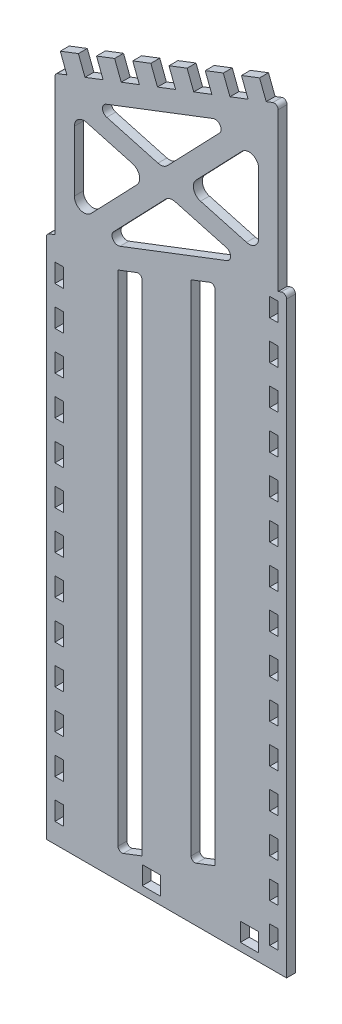
from build123d import *

# Parameters (mm, degrees)
BOSS_EXTRUDE1_DEPTH = 1.4605
SKETCH3_W           = 6.35
SKETCH3_H           = 2.921
BOSS_EXTRUDE2_DEPTH = 6.0452
CUT_EXTRUDE2_DEPTH  = 147.066332108
BOSS_EXTRUDE3_DEPTH = 2.921
SKETCH6_3_W         = 2.75
SKETCH6_3_H         = 6.096
CUT_EXTRUDE3_DEPTH  = 147.77801096
SKETCH6_4_W         = 2.75
SKETCH6_4_H         = 6.096
CUT_EXTRUDE4_DEPTH  = 147.77801096
LPATTERN1_COUNT     = 13
LPATTERN1_PITCH     = 12.7
LPATTERN2_COUNT     = 15
LPATTERN2_PITCH     = 12.7
CUT_EXTRUDE5_DEPTH  = 147.77801096
FILLET1_R           = 1.27
FILLET2_R           = 3.175
FILLET3_R           = 1.905
SKETCH9_W           = 6
SKETCH9_H           = 6
CUT_EXTRUDE6_DEPTH  = 147.77801096


with BuildPart() as part:
    # Sketch1 → Boss-Extrude1 (new, symmetric)
    with BuildSketch(Plane.XY):
        Polygon((-36.517931963, 109.22), (36.517931963, 137.255841429), (36.517931963, -109.22), (-36.517931963, -109.22), align=None)
    extrude(amount=BOSS_EXTRUDE1_DEPTH, both=True)

    # Sketch3 → Boss-Extrude2 (add)
    with BuildSketch(Plane(origin=(-41.231132307, 107.410771898, 0), x_dir=(0.9335804264972012, 0.35836794954530177, 0), z_dir=(-0.35836794954530177, 0.9335804264972012, 0))):
        with Locations((75.914520953, 0)):
            Rectangle(SKETCH3_W, SKETCH3_H)
        with Locations((63.214520953, 0)):
            Rectangle(SKETCH3_W, SKETCH3_H)
        with Locations((50.514520953, 0)):
            Rectangle(SKETCH3_W, SKETCH3_H)
        with Locations((37.814520953, 0)):
            Rectangle(SKETCH3_W, SKETCH3_H)
        with Locations((25.114520953, 0)):
            Rectangle(SKETCH3_W, SKETCH3_H)
        with Locations((12.414520953, 0)):
            Rectangle(SKETCH3_W, SKETCH3_H)
    extrude(amount=BOSS_EXTRUDE2_DEPTH)

    # Sketch5 → Cut-Extrude2 (cut, through all)
    with BuildSketch(Plane.XY.offset(1.4605)):
        Polygon((-15.875, 63.804079158), (-8.001, 66.82662457), (-8.001, -98.27337543), (-15.875, -101.295920842), align=None)
        Polygon((8.001, 72.969216859), (15.875, 75.991762271), (15.875, -89.108237729), (8.001, -92.130783141), align=None)
    extrude(amount=-CUT_EXTRUDE2_DEPTH, mode=Mode.SUBTRACT)

    # Sketch6 → Boss-Extrude3 (add)
    with BuildSketch(Plane.XY.offset(1.4605)):
        Polygon((-39.267931963, 62.444373904), (-39.267931963, -109.22), (-36.517931963, -109.22), (-36.517931963, 63.5), align=None)
        Polygon((39.267931963, 84.971467525), (36.517931963, 83.915841429), (36.517931963, -109.22), (39.267931963, -109.22), align=None)
    extrude(amount=-BOSS_EXTRUDE3_DEPTH)

    # Sketch6<3> → Cut-Extrude3 (cut, through all)
    with BuildSketch(Plane.XY.offset(1.4605)):
        with Locations((-35.142931963, -99.695)):
            Rectangle(SKETCH6_3_W, SKETCH6_3_H)
    cut_extrude3 = extrude(amount=-CUT_EXTRUDE3_DEPTH, mode=Mode.SUBTRACT)

    # Sketch6<4> → Cut-Extrude4 (cut, through all)
    with BuildSketch(Plane.XY.offset(1.4605)):
        with Locations((35.142931963, -99.695)):
            Rectangle(SKETCH6_4_W, SKETCH6_4_H)
    cut_extrude4 = extrude(amount=-CUT_EXTRUDE4_DEPTH, mode=Mode.SUBTRACT)

    # LPattern1: Cut-Extrude3 ×13
    with Locations(*[(0, i * LPATTERN1_PITCH, 0) for i in range(1, LPATTERN1_COUNT)]):
        add(cut_extrude3, mode=Mode.SUBTRACT)

    # LPattern2: Cut-Extrude4 ×15
    with Locations(*[(0, i * LPATTERN2_PITCH, 0) for i in range(1, LPATTERN2_COUNT)]):
        add(cut_extrude4, mode=Mode.SUBTRACT)

    # Sketch8 → Cut-Extrude5 (cut, through all)
    with BuildSketch(Plane.XY.offset(1.4605)):
        Polygon((-30.167931963, 101.563131556), (-30.167931963, 69.705732639), (-5.981784596, 94.918624218), align=None)
        Polygon((0.9822465, 93.005439988), (-23.203900867, 67.792548409), (25.168393866, 86.360932649), align=None)
        Polygon((-25.168393866, 106.77490878), (-0.9822465, 100.130401441), (23.203900867, 125.34329302), align=None)
        Polygon((30.167931963, 123.43010879), (5.981784596, 98.217217211), (30.167931963, 91.572709873), align=None)
    extrude(amount=-CUT_EXTRUDE5_DEPTH, mode=Mode.SUBTRACT)

    # Fillet1
    fillet1_edges = [part.edges().sort_by_distance(p)[0] for p in [
        (8.001, -92.130783141, 0),
        (-15.875, -101.295920842, 0),
        (-8.001, 66.82662457, 0),
        (15.875, 75.991762271, 0),
        (-39.267931963, 62.444373904, 0),
        (39.267931963, 84.971467525, 0),
        (-36.517931963, 109.22, 0),
        (36.517931963, 137.255841429, 0),
    ]]
    fillet(fillet1_edges, radius=FILLET1_R)

    # Fillet2
    fillet2_edges = [part.edges().sort_by_distance(p)[0] for p in [
        (30.167931963, 91.572709873, 0),
        (30.167931963, 123.43010879, 0),
        (-30.167931963, 69.705732639, 0),
        (-30.167931963, 101.563131556, 0),
        (-5.981784596, 94.918624218, 0),
        (5.981784596, 98.217217211, 0),
        (0.9822465, 93.005439988, 0),
        (-0.9822465, 100.130401441, 0),
    ]]
    fillet(fillet2_edges, radius=FILLET2_R)

    # Fillet3
    fillet3_edges = [part.edges().sort_by_distance(p)[0] for p in [
        (-23.203900867, 67.792548409, 0),
        (25.168393866, 86.360932649, 0),
        (23.203900867, 125.34329302, 0),
        (-25.168393866, 106.77490878, 0),
    ]]
    fillet(fillet3_edges, radius=FILLET3_R)

    # Sketch9 → Cut-Extrude6 (cut, through all)
    with BuildSketch(Plane.XY.offset(1.4605)):
        with Locations((-4.932068037, -103.68)):
            Rectangle(SKETCH9_W, SKETCH9_H)
        with Locations((27.167931963, -103.68)):
            Rectangle(SKETCH9_W, SKETCH9_H)
    extrude(amount=-CUT_EXTRUDE6_DEPTH, mode=Mode.SUBTRACT)


solid = part.part
